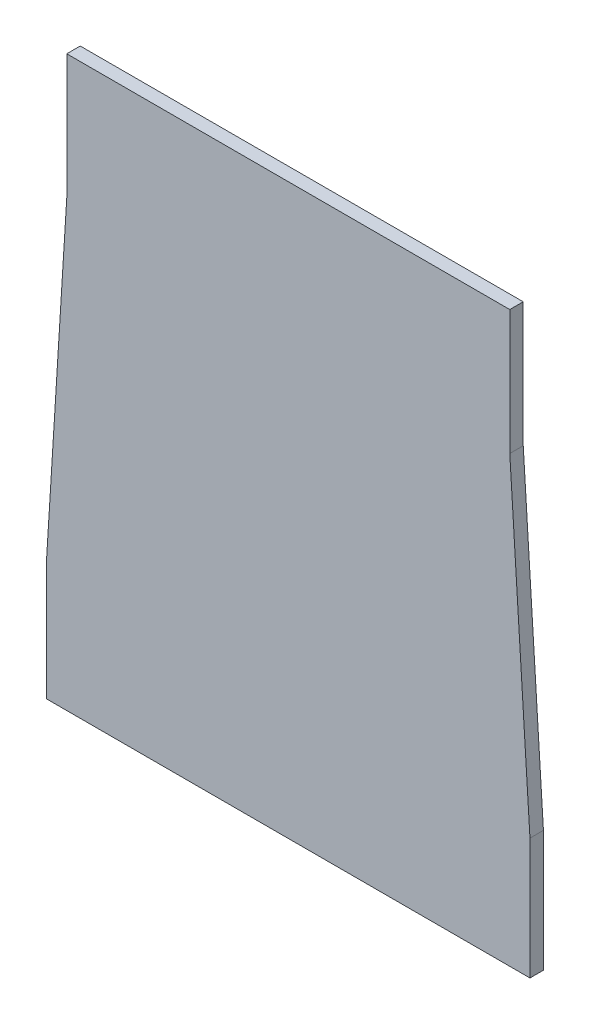
from build123d import *

# Parameters (mm, degrees)
SKETCH1_W           = 418.07892
SKETCH1_H           = 415.925
BOSS_EXTRUDE1_DEPTH = 12.7
SKETCH2_W           = 418.07892
SKETCH2_H           = 107.95
BOSS_EXTRUDE2_DEPTH = 12.7
SKETCH3_W           = 418.07892
SKETCH3_H           = 12.923123126
BOSS_EXTRUDE3_DEPTH = 12.7
BOSS_EXTRUDE4_DEPTH = 12.7
CHAMFER1_SIZE       = 304.8
CHAMFER1_SIZE_2     = 19.05


with BuildPart() as part:
    # Sketch1 → Boss-Extrude1 (new body)
    with BuildSketch(Plane.XY):
        with Locations((0, -5261.217030575)):
            Rectangle(SKETCH1_W, SKETCH1_H)
    extrude(amount=BOSS_EXTRUDE1_DEPTH)

    # Sketch2 → Boss-Extrude2 (add, through all)
    with BuildSketch(Plane(origin=(0, 0, 0), x_dir=(-1, 0, 0), z_dir=(0, 0, -1))):
        with Locations((0, -5523.154530575)):
            Rectangle(SKETCH2_W, SKETCH2_H)
    extrude(amount=-BOSS_EXTRUDE2_DEPTH)

    # Sketch3 → Boss-Extrude3 (add, through all)
    with BuildSketch(Plane(origin=(0, 0, 0), x_dir=(-1, 0, 0), z_dir=(0, 0, -1))):
        with Locations((0, -5046.792969012)):
            Rectangle(SKETCH3_W, SKETCH3_H)
    extrude(amount=-BOSS_EXTRUDE3_DEPTH)

    # Sketch4 → Boss-Extrude4 (add, through all)
    with BuildSketch(Plane(origin=(0, 0, 0), x_dir=(-1, 0, 0), z_dir=(0, 0, -1))):
        Polygon((209.038766336, -5462.805770365), (228.088766336, -5462.805770365), (228.088766336, -5577.129530575), (209.03946, -5577.129530575), align=None)
        Polygon((-209.03946, -5577.129530575), (-209.038766336, -5462.805770365), (-228.088766336, -5462.805770365), (-228.088766336, -5577.129530575), align=None)
    extrude(amount=-BOSS_EXTRUDE4_DEPTH)

    # Chamfer1
    # the kernel refuses this chamfer: 304.8, 19.05 mm, written as the material it adds along each edge
    with BuildSketch(Plane(origin=(-209.03946, -5462.805770365, 0), x_dir=(0.002399337658707147, 0.9999971215852571, 0), z_dir=(0, 0, 1))) as chamfer1_piece_1_section:
        Polygon((CHAMFER1_SIZE * 0.999997121585, CHAMFER1_SIZE * 0.00239933765871), (-CHAMFER1_SIZE_2 * 0.00239933765871, CHAMFER1_SIZE_2 * 0.999997121585), (0, 0), align=None)
    chamfer1_piece_1 = extrude(amount=12.7, mode=Mode.PRIVATE)
    chamfer1_piece_1 = split(chamfer1_piece_1, bisect_by=Plane(origin=(-228.088766336, -5341.135021574, 6.35), z_dir=(1, 0, 0)), keep=Keep.TOP, mode=Mode.PRIVATE)
    add(chamfer1_piece_1)
    with BuildSketch(Plane(origin=(209.03946, -5462.805770365, 0), x_dir=(0.8520963193143735, -0.5233850041899339, 0), z_dir=(0, 0, 1))) as chamfer1_piece_2_section:
        Polygon((CHAMFER1_SIZE_2 * 0.852096319314, CHAMFER1_SIZE_2 * 0.52338500419), (-CHAMFER1_SIZE * 0.52338500419, CHAMFER1_SIZE * 0.852096319314), (0, 0), align=None)
    chamfer1_piece_2 = extrude(amount=12.7, mode=Mode.PRIVATE)
    chamfer1_piece_2 = split(chamfer1_piece_2, bisect_by=Plane(origin=(228.088766336, -5341.135021574, 6.35), z_dir=(-1, 0, 0)), keep=Keep.TOP, mode=Mode.PRIVATE)
    add(chamfer1_piece_2)


solid = part.part
